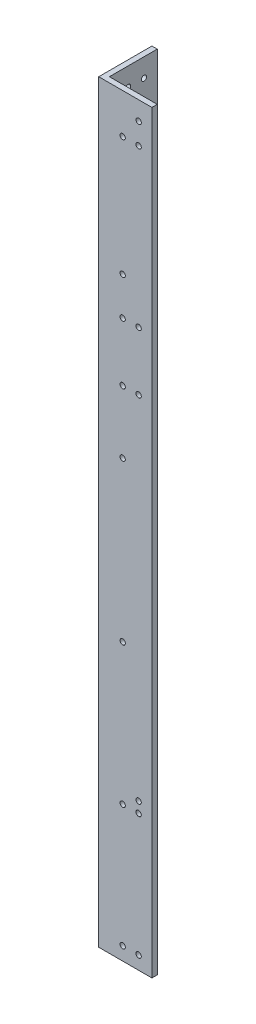
from build123d import *

# Parameters (mm, degrees)
BOSS_EXTRUDE1_DEPTH              = 450
LEFTSIDEHOLES_SKETCH3_R          = 1.5875
LEFTSIDEHOLES_CUT_EXTRUDE1_DEPTH = 3.175
BACKSIDEHOLES_SKETCH4_R          = 1.5875
BACKSIDEHOLES_CUT_EXTRUDE2_DEPTH = 3.175


with BuildPart() as part:
    # Sketch2 → Boss-Extrude1 (new body)
    with BuildSketch(Plane(origin=(0, 0, 0), x_dir=(1, 0, 0), z_dir=(0, 1, 0))):
        Polygon((0, 31.75), (3.175, 31.75), (3.175, 3.175), (31.75, 3.175), (31.75, 0), (0, 0), align=None)
    extrude(amount=BOSS_EXTRUDE1_DEPTH)

    # LeftSideHoles-Sketch3 → LeftSideHoles-Cut-Extrude1 (cut)
    with BuildSketch(Plane.XY):
        with Locations((14.2875, 81.1125)):
            Circle(LEFTSIDEHOLES_SKETCH3_R)
        with Locations((23.8125, 81.1125)):
            Circle(LEFTSIDEHOLES_SKETCH3_R)
        with Locations((23.8125, 87.4625)):
            Circle(LEFTSIDEHOLES_SKETCH3_R)
        with Locations((14.2875, 426.1875)):
            Circle(LEFTSIDEHOLES_SKETCH3_R)
        with Locations((23.8125, 438.8875)):
            Circle(LEFTSIDEHOLES_SKETCH3_R)
        with Locations((23.8125, 426.1875)):
            Circle(LEFTSIDEHOLES_SKETCH3_R)
        with Locations((14.2875, 332.377644)):
            Circle(LEFTSIDEHOLES_SKETCH3_R)
        with Locations((23.8125, 332.377644)):
            Circle(LEFTSIDEHOLES_SKETCH3_R)
        with Locations((14.2875, 297.452644)):
            Circle(LEFTSIDEHOLES_SKETCH3_R)
        with Locations((23.8125, 297.452644)):
            Circle(LEFTSIDEHOLES_SKETCH3_R)
        with Locations((14.2875, 7.9375)):
            Circle(LEFTSIDEHOLES_SKETCH3_R)
        with Locations((23.8125, 7.9375)):
            Circle(LEFTSIDEHOLES_SKETCH3_R)
        with Locations((14.2875, 165)):
            Circle(LEFTSIDEHOLES_SKETCH3_R)
        with Locations((14.2875, 260)):
            Circle(LEFTSIDEHOLES_SKETCH3_R)
        with Locations((14.2875, 355)):
            Circle(LEFTSIDEHOLES_SKETCH3_R)
    extrude(amount=-LEFTSIDEHOLES_CUT_EXTRUDE1_DEPTH, mode=Mode.SUBTRACT)

    # BackSideHoles-Sketch4 → BackSideHoles-Cut-Extrude2 (cut)
    with BuildSketch(Plane.ZY):
        with Locations((-23.8125, 81.1125)):
            Circle(BACKSIDEHOLES_SKETCH4_R)
        with Locations((-23.8125, 87.4625)):
            Circle(BACKSIDEHOLES_SKETCH4_R)
        with Locations((-14.2875, 87.4625)):
            Circle(BACKSIDEHOLES_SKETCH4_R)
        with Locations((-23.8125, 438.8875)):
            Circle(BACKSIDEHOLES_SKETCH4_R)
        with Locations((-14.2875, 438.8875)):
            Circle(BACKSIDEHOLES_SKETCH4_R)
        with Locations((-23.8125, 426.1875)):
            Circle(BACKSIDEHOLES_SKETCH4_R)
        with Locations((-23.8125, 330.777644)):
            Circle(BACKSIDEHOLES_SKETCH4_R)
        with Locations((-14.2875, 330.777644)):
            Circle(BACKSIDEHOLES_SKETCH4_R)
        with Locations((-23.8125, 324.427644)):
            Circle(BACKSIDEHOLES_SKETCH4_R)
        with Locations((-14.2875, 324.427644)):
            Circle(BACKSIDEHOLES_SKETCH4_R)
        with Locations((-14.2875, 165)):
            Circle(BACKSIDEHOLES_SKETCH4_R)
        with Locations((-14.2875, 260)):
            Circle(BACKSIDEHOLES_SKETCH4_R)
        with Locations((-23.8125, 7.9375)):
            Circle(BACKSIDEHOLES_SKETCH4_R)
        with Locations((-14.2875, 7.9375)):
            Circle(BACKSIDEHOLES_SKETCH4_R)
        with Locations((-14.2875, 355)):
            Circle(BACKSIDEHOLES_SKETCH4_R)
    extrude(amount=-BACKSIDEHOLES_CUT_EXTRUDE2_DEPTH, mode=Mode.SUBTRACT)


solid = part.part
